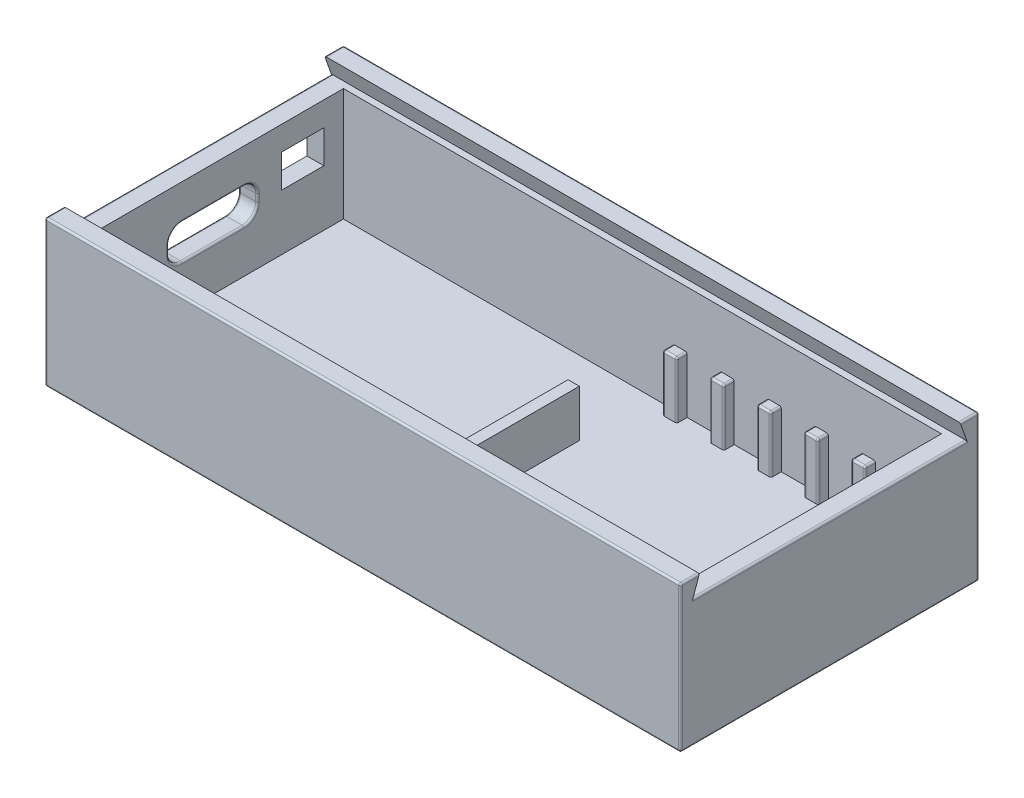
from build123d import *

# Parameters (mm, degrees)
EXTRUDE_1_DEPTH     = 31.7
SKETCH_3_W          = 63.5
SKETCH_3_H          = 2
EXTRUDE_2_DEPTH     = 12
SKETCH_4_W          = 63.5
SKETCH_4_H          = 2
EXTRUDE_3_DEPTH     = 12
SKETCH_5_W          = 1.2
SKETCH_5_H          = 12
EXTRUDE_4_DEPTH     = 5
CUT_EXTRUDE_3_REACH = 77.785
SKETCH_10_W         = 4.5
SKETCH_10_H         = 3.5
CHAMFER_3_SIZE      = 0.2
CUT_EXTRUDE_4_REACH = 77.785
SKETCH_14_W         = 1.5
SKETCH_14_H         = 6
EXTRUDE_7_DEPTH     = 1.1
FILLET_5_R          = 0.2
FILLET_6_R          = 0.2
SKETCH_15_W         = 1.5
SKETCH_15_H         = 6
EXTRUDE_8_DEPTH     = 1.1
FILLET_7_R          = 0.2
EXTRUDE_9_DEPTH     = 67.5
FILLET_8_R          = 0.2
FILLET_9_R          = 0.2
FILLET_10_R         = 0.2
FILLET_11_R         = 0.2


with BuildPart() as part:
    # 草图1 → 凸台-拉伸1 (new body)
    with BuildSketch(Plane.XY):
        Polygon((0, 0), (67.5, 0), (67.5, 13.5), (65.5, 13.5), (65.5, 1.5), (2, 1.5), (2, 13.5), (0, 13.5), align=None)
    extrude(amount=EXTRUDE_1_DEPTH)

    # 草图3 → 凸台-拉伸2 (add, through all)
    with BuildSketch(Plane(origin=(0, 1.5, 0), x_dir=(1, 0, 0), z_dir=(0, 1, 0))):
        with Locations((33.75, -30.7)):
            Rectangle(SKETCH_3_W, SKETCH_3_H)
    extrude(amount=EXTRUDE_2_DEPTH)

    # 草图4 → 凸台-拉伸3 (add, through all)
    with BuildSketch(Plane(origin=(0, 1.5, 0), x_dir=(1, 0, 0), z_dir=(0, 1, 0))):
        with Locations((33.75, -1)):
            Rectangle(SKETCH_4_W, SKETCH_4_H)
    extrude(amount=EXTRUDE_3_DEPTH)

    # 草图5 → 凸台-拉伸4 (add)
    with BuildSketch(Plane(origin=(0, 1.5, 0), x_dir=(1, 0, 0), z_dir=(0, 1, 0))):
        with Locations((34.3, -15.85)):
            Rectangle(SKETCH_5_W, SKETCH_5_H)
    extrude(amount=EXTRUDE_4_DEPTH)

    # 草图10 → 切除-拉伸3 (cut, up to next)
    with BuildSketch(Plane.ZY, mode=Mode.PRIVATE) as cut_extrude_3_sk1:
        with Locations((6.32498095, 9.186156697)):
            Rectangle(SKETCH_10_W, SKETCH_10_H)
    cut_extrude_3_tool1 = extrude(cut_extrude_3_sk1.sketch, amount=-CUT_EXTRUDE_3_REACH, mode=Mode.PRIVATE) & part.part
    add(cut_extrude_3_tool1.solids().sort_by_distance((0, 9.186157, 6.324981))[0], mode=Mode.SUBTRACT)

    # 倒角3
    chamfer_3_edges = [part.edges().sort_by_distance(p)[0] for p in [
        (0, 9.186156697, 4.07498095),
        (0, 7.436156697, 6.32498095),
        (0, 9.186156697, 8.57498095),
        (0, 10.936156697, 6.32498095),
    ]]
    chamfer(chamfer_3_edges, length=CHAMFER_3_SIZE)

    # 草图11 → 切除-拉伸4 (cut, up to next)
    with BuildSketch(Plane.ZY, mode=Mode.PRIVATE) as cut_extrude_4_sk1:
        with BuildLine():
            Line((11.129999793, 8.33615705), (11.129999793, 7.576157015))
            ThreePointArc((11.129999793, 7.576157015), (11.554694976, 6.550852144), (12.579999847, 6.126156961))
            Line((12.579999847, 6.126156961), (19.120000153, 6.126156961))
            ThreePointArc((19.120000153, 6.126156961), (20.145305024, 6.550852144), (20.570000207, 7.576157015))
            Line((20.570000207, 7.576157015), (20.570000207, 8.33615705))
            ThreePointArc((20.570000207, 8.33615705), (20.145305024, 9.361461921), (19.120000153, 9.786157104))
            Line((19.120000153, 9.786157104), (12.579999847, 9.786157104))
            ThreePointArc((12.579999847, 9.786157104), (11.554694976, 9.361461921), (11.129999793, 8.33615705))
        make_face()
    cut_extrude_4_tool1 = extrude(cut_extrude_4_sk1.sketch, amount=-CUT_EXTRUDE_4_REACH, mode=Mode.PRIVATE) & part.part
    add(cut_extrude_4_tool1.solids().sort_by_distance((0, 7.956157, 15.85))[0], mode=Mode.SUBTRACT)

    # 草图14 → 凸台-拉伸7 (add)
    with BuildSketch(Plane.XY.offset(2)):
        with Locations((62.745360324, 4.5)):
            Rectangle(SKETCH_14_W, SKETCH_14_H)
        with Locations((57.745360324, 4.5)):
            Rectangle(SKETCH_14_W, SKETCH_14_H)
        with Locations((52.745360324, 4.5)):
            Rectangle(SKETCH_14_W, SKETCH_14_H)
        with Locations((47.745360324, 4.5)):
            Rectangle(SKETCH_14_W, SKETCH_14_H)
        with Locations((42.745360324, 4.5)):
            Rectangle(SKETCH_14_W, SKETCH_14_H)
        with Locations((37.745360324, 4.5)):
            Rectangle(SKETCH_14_W, SKETCH_14_H)
    extrude(amount=EXTRUDE_7_DEPTH)

    # 圆角5
    fillet_5_edges = [part.edges().sort_by_distance(p)[0] for p in [
        (63.495360324, 4.5, 3.1),
        (62.745360324, 7.5, 3.1),
        (61.995360324, 4.5, 3.1),
        (58.495360324, 4.5, 3.1),
        (57.745360324, 7.5, 3.1),
        (56.995360324, 4.5, 3.1),
        (53.495360324, 4.5, 3.1),
        (52.745360324, 7.5, 3.1),
        (51.995360324, 4.5, 3.1),
        (48.495360324, 4.5, 3.1),
        (47.745360324, 7.5, 3.1),
        (46.995360324, 4.5, 3.1),
        (43.495360324, 4.5, 3.1),
        (42.745360324, 7.5, 3.1),
        (41.995360324, 4.5, 3.1),
        (38.495360324, 4.5, 3.1),
        (37.745360324, 7.5, 3.1),
        (36.995360324, 4.5, 3.1),
    ]]
    fillet(fillet_5_edges, radius=FILLET_5_R)

    # 圆角6
    # the kernel refuses this fillet: 0.2 mm, written as the material it takes off along each edge
    with BuildSketch(Plane(origin=(62.195360324, 7.3, 2.9), x_dir=(0, 1, 0), z_dir=(-1, 0, 0))) as fillet_6_piece_1_section:
        Polygon((0, 0), (FILLET_6_R * 1.02, 0), (FILLET_6_R * 1.02, -FILLET_6_R * 1.02), (0, -FILLET_6_R * 1.02), align=None)
    fillet_6_piece_1 = extrude(amount=FILLET_6_R * 1.02, mode=Mode.PRIVATE)
    fillet_6_piece_1 = fillet_6_piece_1 - Plane(origin=(62.195360324, 7.3, 2.9), x_dir=(0, -0.7071067811865475, -0.7071067811865475), z_dir=(-1, 0, 0)) * Sphere(FILLET_6_R, mode=Mode.PRIVATE)
    add(fillet_6_piece_1, mode=Mode.SUBTRACT)
    with BuildSketch(Plane(origin=(63.295360324, 7.3, 2.9), x_dir=(0, 1, 0), z_dir=(1, 0, 0))) as fillet_6_piece_2_section:
        Polygon((0, 0), (FILLET_6_R * 1.02, 0), (FILLET_6_R * 1.02, FILLET_6_R * 1.02), (0, FILLET_6_R * 1.02), align=None)
    fillet_6_piece_2 = extrude(amount=FILLET_6_R * 1.02, mode=Mode.PRIVATE)
    fillet_6_piece_2 = fillet_6_piece_2 - Plane(origin=(63.295360324, 7.3, 2.9), x_dir=(0, -0.7071067811865475, -0.7071067811865475), z_dir=(1, 0, 0)) * Sphere(FILLET_6_R, mode=Mode.PRIVATE)
    add(fillet_6_piece_2, mode=Mode.SUBTRACT)
    with BuildSketch(Plane(origin=(57.195360324, 7.3, 2.9), x_dir=(0, 1, 0), z_dir=(-1, 0, 0))) as fillet_6_piece_3_section:
        Polygon((0, 0), (FILLET_6_R * 1.02, 0), (FILLET_6_R * 1.02, -FILLET_6_R * 1.02), (0, -FILLET_6_R * 1.02), align=None)
    fillet_6_piece_3 = extrude(amount=FILLET_6_R * 1.02, mode=Mode.PRIVATE)
    fillet_6_piece_3 = fillet_6_piece_3 - Plane(origin=(57.195360324, 7.3, 2.9), x_dir=(0, -0.7071067811865475, -0.7071067811865475), z_dir=(-1, 0, 0)) * Sphere(FILLET_6_R, mode=Mode.PRIVATE)
    add(fillet_6_piece_3, mode=Mode.SUBTRACT)
    with BuildSketch(Plane(origin=(58.295360324, 7.3, 2.9), x_dir=(0, 1, 0), z_dir=(1, 0, 0))) as fillet_6_piece_4_section:
        Polygon((0, 0), (FILLET_6_R * 1.02, 0), (FILLET_6_R * 1.02, FILLET_6_R * 1.02), (0, FILLET_6_R * 1.02), align=None)
    fillet_6_piece_4 = extrude(amount=FILLET_6_R * 1.02, mode=Mode.PRIVATE)
    fillet_6_piece_4 = fillet_6_piece_4 - Plane(origin=(58.295360324, 7.3, 2.9), x_dir=(0, -0.7071067811865475, -0.7071067811865475), z_dir=(1, 0, 0)) * Sphere(FILLET_6_R, mode=Mode.PRIVATE)
    add(fillet_6_piece_4, mode=Mode.SUBTRACT)
    with BuildSketch(Plane(origin=(52.195360324, 7.3, 2.9), x_dir=(0, 1, 0), z_dir=(-1, 0, 0))) as fillet_6_piece_5_section:
        Polygon((0, 0), (FILLET_6_R * 1.02, 0), (FILLET_6_R * 1.02, -FILLET_6_R * 1.02), (0, -FILLET_6_R * 1.02), align=None)
    fillet_6_piece_5 = extrude(amount=FILLET_6_R * 1.02, mode=Mode.PRIVATE)
    fillet_6_piece_5 = fillet_6_piece_5 - Plane(origin=(52.195360324, 7.3, 2.9), x_dir=(0, -0.7071067811865475, -0.7071067811865475), z_dir=(-1, 0, 0)) * Sphere(FILLET_6_R, mode=Mode.PRIVATE)
    add(fillet_6_piece_5, mode=Mode.SUBTRACT)
    with BuildSketch(Plane(origin=(53.295360324, 7.3, 2.9), x_dir=(0, 1, 0), z_dir=(1, 0, 0))) as fillet_6_piece_6_section:
        Polygon((0, 0), (FILLET_6_R * 1.02, 0), (FILLET_6_R * 1.02, FILLET_6_R * 1.02), (0, FILLET_6_R * 1.02), align=None)
    fillet_6_piece_6 = extrude(amount=FILLET_6_R * 1.02, mode=Mode.PRIVATE)
    fillet_6_piece_6 = fillet_6_piece_6 - Plane(origin=(53.295360324, 7.3, 2.9), x_dir=(0, -0.7071067811865475, -0.7071067811865475), z_dir=(1, 0, 0)) * Sphere(FILLET_6_R, mode=Mode.PRIVATE)
    add(fillet_6_piece_6, mode=Mode.SUBTRACT)
    with BuildSketch(Plane(origin=(47.195360324, 7.3, 2.9), x_dir=(0, 1, 0), z_dir=(-1, 0, 0))) as fillet_6_piece_7_section:
        Polygon((0, 0), (FILLET_6_R * 1.02, 0), (FILLET_6_R * 1.02, -FILLET_6_R * 1.02), (0, -FILLET_6_R * 1.02), align=None)
    fillet_6_piece_7 = extrude(amount=FILLET_6_R * 1.02, mode=Mode.PRIVATE)
    fillet_6_piece_7 = fillet_6_piece_7 - Plane(origin=(47.195360324, 7.3, 2.9), x_dir=(0, -0.7071067811865475, -0.7071067811865475), z_dir=(-1, 0, 0)) * Sphere(FILLET_6_R, mode=Mode.PRIVATE)
    add(fillet_6_piece_7, mode=Mode.SUBTRACT)
    with BuildSketch(Plane(origin=(48.295360324, 7.3, 2.9), x_dir=(0, 1, 0), z_dir=(1, 0, 0))) as fillet_6_piece_8_section:
        Polygon((0, 0), (FILLET_6_R * 1.02, 0), (FILLET_6_R * 1.02, FILLET_6_R * 1.02), (0, FILLET_6_R * 1.02), align=None)
    fillet_6_piece_8 = extrude(amount=FILLET_6_R * 1.02, mode=Mode.PRIVATE)
    fillet_6_piece_8 = fillet_6_piece_8 - Plane(origin=(48.295360324, 7.3, 2.9), x_dir=(0, -0.7071067811865475, -0.7071067811865475), z_dir=(1, 0, 0)) * Sphere(FILLET_6_R, mode=Mode.PRIVATE)
    add(fillet_6_piece_8, mode=Mode.SUBTRACT)
    with BuildSketch(Plane(origin=(42.195360324, 7.3, 2.9), x_dir=(0, 1, 0), z_dir=(-1, 0, 0))) as fillet_6_piece_9_section:
        Polygon((0, 0), (FILLET_6_R * 1.02, 0), (FILLET_6_R * 1.02, -FILLET_6_R * 1.02), (0, -FILLET_6_R * 1.02), align=None)
    fillet_6_piece_9 = extrude(amount=FILLET_6_R * 1.02, mode=Mode.PRIVATE)
    fillet_6_piece_9 = fillet_6_piece_9 - Plane(origin=(42.195360324, 7.3, 2.9), x_dir=(0, -0.7071067811865475, -0.7071067811865475), z_dir=(-1, 0, 0)) * Sphere(FILLET_6_R, mode=Mode.PRIVATE)
    add(fillet_6_piece_9, mode=Mode.SUBTRACT)
    with BuildSketch(Plane(origin=(43.295360324, 7.3, 2.9), x_dir=(0, 1, 0), z_dir=(1, 0, 0))) as fillet_6_piece_10_section:
        Polygon((0, 0), (FILLET_6_R * 1.02, 0), (FILLET_6_R * 1.02, FILLET_6_R * 1.02), (0, FILLET_6_R * 1.02), align=None)
    fillet_6_piece_10 = extrude(amount=FILLET_6_R * 1.02, mode=Mode.PRIVATE)
    fillet_6_piece_10 = fillet_6_piece_10 - Plane(origin=(43.295360324, 7.3, 2.9), x_dir=(0, -0.7071067811865475, -0.7071067811865475), z_dir=(1, 0, 0)) * Sphere(FILLET_6_R, mode=Mode.PRIVATE)
    add(fillet_6_piece_10, mode=Mode.SUBTRACT)
    with BuildSketch(Plane(origin=(37.195360324, 7.3, 2.9), x_dir=(0, 1, 0), z_dir=(-1, 0, 0))) as fillet_6_piece_11_section:
        Polygon((0, 0), (FILLET_6_R * 1.02, 0), (FILLET_6_R * 1.02, -FILLET_6_R * 1.02), (0, -FILLET_6_R * 1.02), align=None)
    fillet_6_piece_11 = extrude(amount=FILLET_6_R * 1.02, mode=Mode.PRIVATE)
    fillet_6_piece_11 = fillet_6_piece_11 - Plane(origin=(37.195360324, 7.3, 2.9), x_dir=(0, -0.7071067811865475, -0.7071067811865475), z_dir=(-1, 0, 0)) * Sphere(FILLET_6_R, mode=Mode.PRIVATE)
    add(fillet_6_piece_11, mode=Mode.SUBTRACT)
    with BuildSketch(Plane(origin=(38.295360324, 7.3, 2.9), x_dir=(0, 1, 0), z_dir=(1, 0, 0))) as fillet_6_piece_12_section:
        Polygon((0, 0), (FILLET_6_R * 1.02, 0), (FILLET_6_R * 1.02, FILLET_6_R * 1.02), (0, FILLET_6_R * 1.02), align=None)
    fillet_6_piece_12 = extrude(amount=FILLET_6_R * 1.02, mode=Mode.PRIVATE)
    fillet_6_piece_12 = fillet_6_piece_12 - Plane(origin=(38.295360324, 7.3, 2.9), x_dir=(0, -0.7071067811865475, -0.7071067811865475), z_dir=(1, 0, 0)) * Sphere(FILLET_6_R, mode=Mode.PRIVATE)
    add(fillet_6_piece_12, mode=Mode.SUBTRACT)
    with BuildSketch(Plane(origin=(63.495360324, 7.5, 2), x_dir=(0, -1, 0), z_dir=(0, 0, 1)), Plane(origin=(58.495360324, 7.5, 2), x_dir=(0, -1, 0), z_dir=(0, 0, 1)), Plane(origin=(53.495360324, 7.5, 2), x_dir=(0, -1, 0), z_dir=(0, 0, 1)), Plane(origin=(48.495360324, 7.5, 2), x_dir=(0, -1, 0), z_dir=(0, 0, 1)), Plane(origin=(43.495360324, 7.5, 2), x_dir=(0, -1, 0), z_dir=(0, 0, 1)), Plane(origin=(38.495360324, 7.5, 2), x_dir=(0, -1, 0), z_dir=(0, 0, 1))) as fillet_6_piece_13:
        with BuildLine():
            CenterArc((FILLET_6_R, -FILLET_6_R), FILLET_6_R, 90, 90)
            Line((0, -FILLET_6_R), (0, 0))
            Line((0, 0), (FILLET_6_R, 0))
        make_face()
    extrude(amount=0.9, mode=Mode.SUBTRACT)
    with BuildSketch(Plane(origin=(61.995360324, 7.5, 2), x_dir=(0, -1, 0), z_dir=(0, 0, 1)), Plane(origin=(56.995360324, 7.5, 2), x_dir=(0, -1, 0), z_dir=(0, 0, 1)), Plane(origin=(51.995360324, 7.5, 2), x_dir=(0, -1, 0), z_dir=(0, 0, 1)), Plane(origin=(46.995360324, 7.5, 2), x_dir=(0, -1, 0), z_dir=(0, 0, 1)), Plane(origin=(41.995360324, 7.5, 2), x_dir=(0, -1, 0), z_dir=(0, 0, 1)), Plane(origin=(36.995360324, 7.5, 2), x_dir=(0, -1, 0), z_dir=(0, 0, 1))) as fillet_6_piece_14:
        with BuildLine():
            CenterArc((FILLET_6_R, FILLET_6_R), FILLET_6_R, 180, 90)
            Line((0, FILLET_6_R), (0, 0))
            Line((0, 0), (FILLET_6_R, 0))
        make_face()
    extrude(amount=0.9, mode=Mode.SUBTRACT)

    # 草图15 → 凸台-拉伸8 (add)
    with BuildSketch(Plane(origin=(0, 0, 29.7), x_dir=(-1, 0, 0), z_dir=(0, 0, -1))):
        with Locations((-62.75, 4.5)):
            Rectangle(SKETCH_15_W, SKETCH_15_H)
        with Locations((-57.75, 4.5)):
            Rectangle(SKETCH_15_W, SKETCH_15_H)
        with Locations((-52.75, 4.5)):
            Rectangle(SKETCH_15_W, SKETCH_15_H)
        with Locations((-47.75, 4.5)):
            Rectangle(SKETCH_15_W, SKETCH_15_H)
        with Locations((-42.75, 4.5)):
            Rectangle(SKETCH_15_W, SKETCH_15_H)
        with Locations((-37.75, 4.5)):
            Rectangle(SKETCH_15_W, SKETCH_15_H)
    extrude(amount=EXTRUDE_8_DEPTH)

    # 圆角7
    fillet_7_edges = [part.edges().sort_by_distance(p)[0] for p in [
        (63.5, 7.5, 29.15),
        (62, 7.5, 29.15),
        (63.5, 4.5, 28.6),
        (62, 4.5, 28.6),
        (62.75, 7.5, 28.6),
        (57, 7.5, 29.15),
        (58.5, 7.5, 29.15),
        (57, 4.5, 28.6),
        (57.75, 7.5, 28.6),
        (58.5, 4.5, 28.6),
        (52, 7.5, 29.15),
        (53.5, 7.5, 29.15),
        (52, 4.5, 28.6),
        (52.75, 7.5, 28.6),
        (53.5, 4.5, 28.6),
        (47, 7.5, 29.15),
        (48.5, 7.5, 29.15),
        (47, 4.5, 28.6),
        (47.75, 7.5, 28.6),
        (48.5, 4.5, 28.6),
        (42, 7.5, 29.15),
        (43.5, 7.5, 29.15),
        (42, 4.5, 28.6),
        (42.75, 7.5, 28.6),
        (43.5, 4.5, 28.6),
        (37, 7.5, 29.15),
        (38.5, 7.5, 29.15),
        (37, 4.5, 28.6),
        (37.75, 7.5, 28.6),
        (38.5, 4.5, 28.6),
    ]]
    fillet(fillet_7_edges, radius=FILLET_7_R)

    # 草图16 → 凸台-拉伸9 (add, through all)
    with BuildSketch(Plane.ZY):
        Polygon((0, 13.5), (0, 15.5), (2, 15.5), (1.3, 13.5), align=None)
        Polygon((30.4, 13.5), (31.7, 13.5), (31.7, 15.5), (29.7, 15.5), align=None)
    extrude(amount=-EXTRUDE_9_DEPTH)

    # 圆角8
    fillet_8_edges = [part.edges().sort_by_distance(p)[0] for p in [
        (0, 9.361461921, 11.554694976),
        (0, 7.956157032, 11.129999793),
        (0, 6.550852144, 11.554694976),
        (0, 6.126156961, 15.85),
        (0, 6.550852144, 20.145305024),
        (0, 7.956157032, 20.570000207),
        (0, 9.361461921, 20.145305024),
        (0, 9.786157104, 15.85),
    ]]
    fillet(fillet_8_edges, radius=FILLET_8_R)

    # 圆角9
    fillet_9_edges = [part.edges().sort_by_distance(p)[0] for p in [
        (33.75, 15.5, 0),
        (67.5, 13.5, 15.85),
        (0, 13.5, 15.85),
        (33.75, 15.5, 31.7),
    ]]
    fillet(fillet_9_edges, radius=FILLET_9_R)

    # 圆角10
    fillet_10_edges = [part.edges().sort_by_distance(p)[0] for p in [
        (67.5, 7.65, 0),
        (33.75, 0, 0),
        (67.5, 7.65, 31.7),
        (67.5, 0, 15.85),
        (0, 0, 15.85),
        (67.5, 15.5, 1.1),
        (0, 15.5, 1.1),
        (67.5, 15.5, 30.6),
        (67.5, 15.441421356, 31.641421356),
        (67.5, 15.441421356, 0.058578644),
        (0, 7.65, 0),
        (0, 7.65, 31.7),
        (0, 15.5, 30.6),
        (0, 15.441421356, 31.641421356),
        (0, 15.441421356, 0.058578644),
        (33.75, 0, 31.7),
    ]]
    fillet(fillet_10_edges, radius=FILLET_10_R)

    # 圆角11
    fillet_11_edges = [part.edges().sort_by_distance(p)[0] for p in [
        (2, 7.956157032, 11.129999793),
        (2, 9.361461921, 11.554694976),
        (2, 9.786157104, 15.85),
        (2, 9.361461921, 20.145305024),
        (2, 7.956157032, 20.570000207),
        (2, 6.550852144, 20.145305024),
        (2, 6.126156961, 15.85),
        (2, 6.550852144, 11.554694976),
    ]]
    fillet(fillet_11_edges, radius=FILLET_11_R)


solid = part.part
